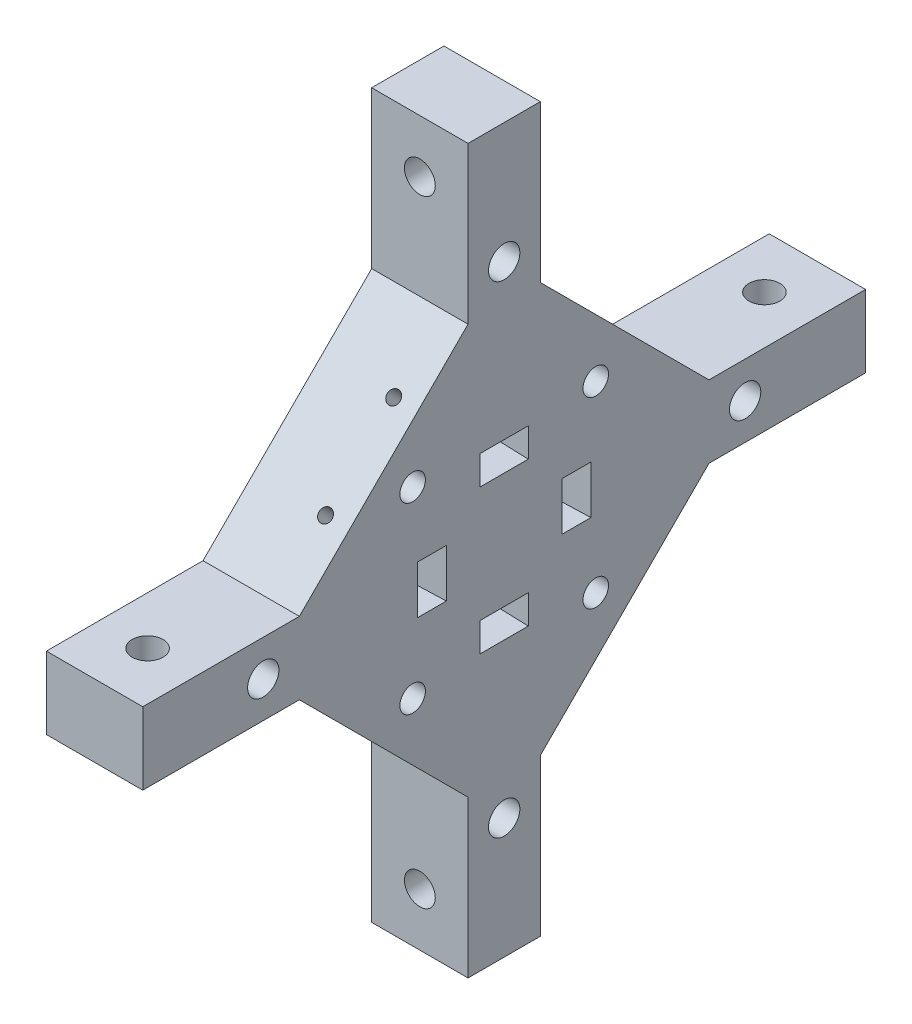
from build123d import *

# Parameters (mm, degrees)
SKETCH1_W               = 50
SKETCH1_H               = 50
SKETCH1_R               = 1.7
BOSS_EXTRUDE1_DEPTH     = 20
CUT_EXTRUDE1_START      = -12.5
SKETCH2_R               = 2.65
SKETCH2_R_2             = 1.7
CUT_EXTRUDE1_DEPTH      = 12.5
BOSS_EXTRUDE3_DEPTH     = 20
SKETCH5_W               = 4
SKETCH5_H               = 10
SKETCH5_W_2             = 10
SKETCH5_H_2             = 4
CUT_EXTRUDE2_DEPTH      = 8
CHAMFER1_START          = -5
CHAMFER1_DEPTH          = 10
CHAMFER1_START_2        = -17.720633844
CHAMFER1_2_OUTLINE_W    = 8
CHAMFER1_2_OUTLINE_H    = 10
CHAMFER1_2_DEPTH        = 5.441267688
CHAMFER1_START_3        = 12.279366156
CHAMFER1_3_OUTLINE_W    = 8
CHAMFER1_3_OUTLINE_H    = 10
CHAMFER1_3_DEPTH        = 5.441267688
CHAMFER1_4_DEPTH        = 10
CUT_EXTRUDE4_DEPTH      = 108.935165725
CUT_EXTRUDE4_DEPTH_BACK = 108.935165725
SKETCH7_R               = 3.25
SKETCH8_R               = 3.2
CUT_EXTRUDE5_DEPTH      = 114.275107592
CIRPATTERN1_COUNT       = 4
SKETCH9_R               = 1.35
CUT_EXTRUDE6_DEPTH      = 15
CIRPATTERN2_COUNT       = 4


with BuildPart() as part:
    # Sketch1 → Boss-Extrude1 (new body)
    with BuildSketch(Plane(origin=(0, 0, 0), x_dir=(0, 0, -1), z_dir=(1, 0, 0))):
        Rectangle(SKETCH1_W, SKETCH1_H)
        with Locations((-19, 19)):
            Circle(SKETCH1_R, mode=Mode.SUBTRACT)
        with Locations((19, 19)):
            Circle(SKETCH1_R, mode=Mode.SUBTRACT)
        with Locations((19, -19)):
            Circle(SKETCH1_R, mode=Mode.SUBTRACT)
        with Locations((-19, -19)):
            Circle(SKETCH1_R, mode=Mode.SUBTRACT)
    extrude(amount=BOSS_EXTRUDE1_DEPTH)

    # Sketch2 → Cut-Extrude1 (cut)
    # profile 1 of 4: a face of its own
    with BuildSketch(Plane(origin=(20, 0, 0), x_dir=(0, 0, -1), z_dir=(1, 0, 0)).offset(CUT_EXTRUDE1_START)):
        with Locations((-19, 19)):
            Circle(SKETCH2_R)
        with Locations((-19, 19)):
            Circle(SKETCH2_R_2, mode=Mode.SUBTRACT)
    # profile 2 of 4: a face of its own
    with BuildSketch(Plane(origin=(20, 0, 0), x_dir=(0, 0, -1), z_dir=(1, 0, 0)).offset(CUT_EXTRUDE1_START)):
        with Locations((19, 19)):
            Circle(SKETCH2_R)
        with Locations((19, 19)):
            Circle(SKETCH2_R_2, mode=Mode.SUBTRACT)
    # profile 3 of 4: a face of its own
    with BuildSketch(Plane(origin=(20, 0, 0), x_dir=(0, 0, -1), z_dir=(1, 0, 0)).offset(CUT_EXTRUDE1_START)):
        with Locations((19, -19)):
            Circle(SKETCH2_R)
        with Locations((19, -19)):
            Circle(SKETCH2_R_2, mode=Mode.SUBTRACT)
    # profile 4 of 4: a face of its own
    with BuildSketch(Plane(origin=(20, 0, 0), x_dir=(0, 0, -1), z_dir=(1, 0, 0)).offset(CUT_EXTRUDE1_START)):
        with Locations((-19, -19)):
            Circle(SKETCH2_R)
        with Locations((-19, -19)):
            Circle(SKETCH2_R_2, mode=Mode.SUBTRACT)
    extrude(amount=CUT_EXTRUDE1_DEPTH, mode=Mode.SUBTRACT)

    # Sketch3 → Cut-Revolve1 (revolve, cut)
    with BuildSketch(Plane(origin=(0, 0, 0), x_dir=(1, 0, 0), z_dir=(0, 1, 0))):
        with BuildLine():
            Line((0, 0), (0, 15.125))
            ThreePointArc((0, 15.125), (10.694990065, 10.694990065), (15.125, 0))
            Line((15.125, 0), (0, 0))
        make_face()
    revolve(axis=Axis((-993.762626263, 0, 0), (1, 0, 0)), mode=Mode.SUBTRACT)

    # Sketch4 → Boss-Extrude3 (add)
    with BuildSketch(Plane(origin=(20, 0, 0), x_dir=(0, 0, -1), z_dir=(1, 0, 0))):
        Polygon((42.5, 7.5), (25, 25), (25, -25), (42.5, -7.5), (75, -7.5), (75, 7.5), align=None)
        Polygon((-25, 25), (25, 25), (7.5, 42.5), (7.5, 75), (-7.5, 75), (-7.5, 42.5), align=None)
        Polygon((7.5, -42.5), (25, -25), (-25, -25), (-7.5, -42.5), (-7.5, -75), (7.5, -75), align=None)
        Polygon((-25, -25), (-25, 25), (-42.5, 7.5), (-75, 7.5), (-75, -7.5), (-42.5, -7.5), align=None)
    extrude(amount=-BOSS_EXTRUDE3_DEPTH)

    # Sketch5 → Cut-Extrude2 (cut)
    with BuildSketch(Plane(origin=(20, 0, 0), x_dir=(0, 0, -1), z_dir=(1, 0, 0))):
        with Locations((15, 0)):
            Rectangle(SKETCH5_W, SKETCH5_H)
        with Locations((0, 15)):
            Rectangle(SKETCH5_W_2, SKETCH5_H_2)
        with Locations((0, -15)):
            Rectangle(SKETCH5_W_2, SKETCH5_H_2)
        with Locations((-15, 0)):
            Rectangle(SKETCH5_W, SKETCH5_H)
    extrude(amount=-CUT_EXTRUDE2_DEPTH, mode=Mode.SUBTRACT)

    # Chamfer1: read off the stored shape, not the designer's step
    # Chamfer1 outline → Chamfer1 (cut)
    with BuildSketch(Plane(origin=(0, 0, 0), x_dir=(1, 0, 0), z_dir=(0, 1, 0)).offset(CHAMFER1_START)):
        Polygon((12, 12.279366156), (20, 12), (20, 13), (12, 13), align=None)
        Polygon((12, -17), (12, -17.720633844), (20, -18), (20, -17), align=None)
        Polygon((12, -12.279366156), (12, -13), (20, -13), (20, -12), align=None)
        Polygon((12, 17), (20, 17), (20, 18), (12, 17.720633844), align=None)
    extrude(amount=CHAMFER1_DEPTH, mode=Mode.SUBTRACT)

    # Chamfer1 2 outline → Chamfer1 2 (cut)
    with BuildSketch(Plane(origin=(0, 0, 0), x_dir=(1, 0, 0), z_dir=(0, 1, 0)).offset(CHAMFER1_START_2)):
        with Locations((16, 0)):
            Rectangle(CHAMFER1_2_OUTLINE_W, CHAMFER1_2_OUTLINE_H)
    extrude(amount=CHAMFER1_2_DEPTH, mode=Mode.SUBTRACT)

    # Chamfer1 3 outline → Chamfer1 3 (cut)
    with BuildSketch(Plane(origin=(0, 0, 0), x_dir=(1, 0, 0), z_dir=(0, 1, 0)).offset(CHAMFER1_START_3)):
        with Locations((16, 0)):
            Rectangle(CHAMFER1_3_OUTLINE_W, CHAMFER1_3_OUTLINE_H)
    extrude(amount=CHAMFER1_3_DEPTH, mode=Mode.SUBTRACT)

    # Chamfer1 4 outline → Chamfer1 4 (cut)
    with BuildSketch(Plane.XY.offset(CHAMFER1_START)):
        Polygon((12, 17.720633844), (20, 17.720633844), (20, 18), align=None)
        Polygon((12, 12.279366156), (20, 12), (20, 12.279366156), align=None)
        Polygon((20, -18), (20, -17.720633844), (12, -17.720633844), align=None)
        Polygon((20, -12), (12, -12.279366156), (20, -12.279366156), align=None)
    extrude(amount=CHAMFER1_4_DEPTH, mode=Mode.SUBTRACT)

    # Sketch7 → Cut-Extrude4 (cut, two sides: drawn at the far end of the back side and taken through both)
    with BuildSketch(Plane(origin=(20, 0, 0), x_dir=(0, 0, -1), z_dir=(1, 0, 0)).offset(-CUT_EXTRUDE4_DEPTH_BACK)):
        with Locations((50, 0)):
            Circle(SKETCH7_R)
        with Locations((0, -50)):
            Circle(SKETCH7_R)
        with Locations((-50, 0)):
            Circle(SKETCH7_R)
        with Locations((0, 50)):
            Circle(SKETCH7_R)
    extrude(amount=CUT_EXTRUDE4_DEPTH + CUT_EXTRUDE4_DEPTH_BACK, mode=Mode.SUBTRACT)

    # Sketch8 → Cut-Extrude5 (cut, symmetric)
    with BuildSketch(Plane.XZ.offset(7.5)):
        with Locations(Location((10, -64, 0), (0, 0, 270))):
            Circle(SKETCH8_R)
    cut_extrude5 = extrude(amount=CUT_EXTRUDE5_DEPTH, both=True, mode=Mode.SUBTRACT)

    # CirPattern1: Cut-Extrude5 ×4 about axis
    cirpattern1_axis = Axis((20, 0, 0), (1, 0, 0))
    for i in range(1, CIRPATTERN1_COUNT):
        add(cut_extrude5.rotate(cirpattern1_axis, i * 360 / CIRPATTERN1_COUNT), mode=Mode.SUBTRACT)

    # Sketch9 → Cut-Extrude6 (cut)
    with BuildSketch(Plane(origin=(0, -25, -25), x_dir=(1, 0, 0), z_dir=(0, -0.7071067811865438, -0.7071067811865513))):
        with Locations(Location((15, 10, 0), (0, 0, 270))):
            Circle(SKETCH9_R)
        with Locations(Location((15, -10, 0), (0, 0, 270))):
            Circle(SKETCH9_R)
    cut_extrude6 = extrude(amount=-CUT_EXTRUDE6_DEPTH, mode=Mode.SUBTRACT)

    # CirPattern2: Cut-Extrude6 ×4 about axis
    cirpattern2_axis = Axis((0, 0, 0), (1, 0, 0))
    for i in range(1, CIRPATTERN2_COUNT):
        add(cut_extrude6.rotate(cirpattern2_axis, i * 360 / CIRPATTERN2_COUNT), mode=Mode.SUBTRACT)


solid = part.part
